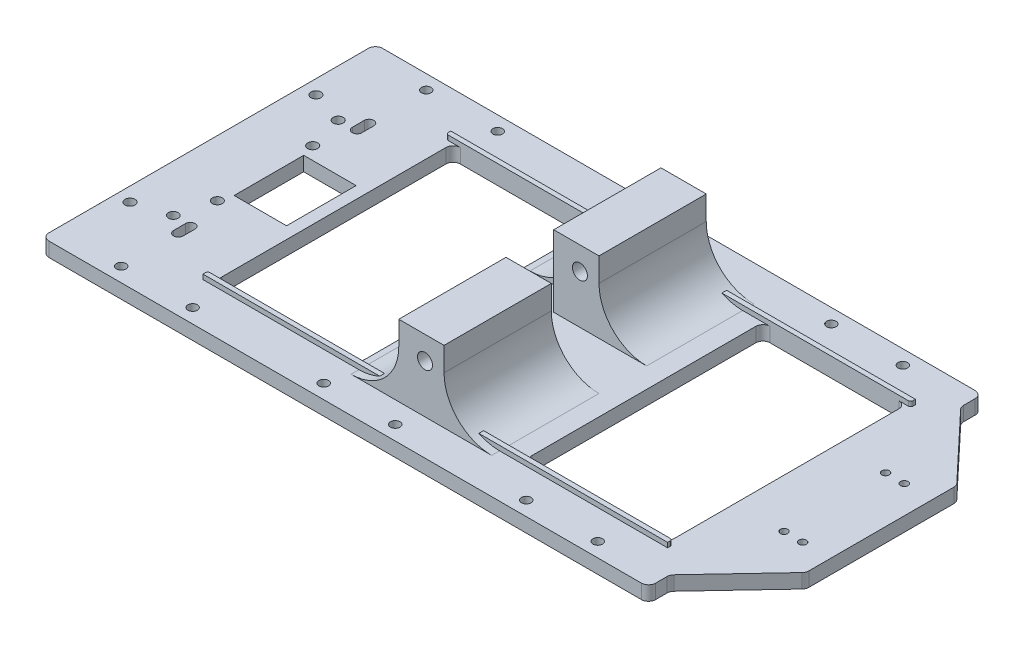
from build123d import *

# Parameters (mm, degrees)
SKETCH_1_R                = 2.1
SKETCH_1_R_2              = 2.05
SKETCH_1_R_3              = 1.55
SKETCH_1_R_4              = 2
SKETCH_1_R_5              = 1.6
SKETCH_1_R_6              = 1.5
SKETCH_1_R_7              = 6
SKETCH_1_W                = 22
SKETCH_1_H                = 29.2
EXTRUDE_1_DEPTH           = 6
EXTRUDE_START             = -6
SKETCH_3_W                = 203.58361069
SKETCH_3_H                = 116.131566858
SKETCH_3_R                = 2.1
SKETCH_3_R_2              = 1.5
SKETCH_3_R_3              = 1.6
SKETCH_3_R_4              = 6
EXTRUDE_2_DEPTH           = 6
CUT_EXTRUDE_1_DEPTH       = 4593.701999583
CUT_EXTRUDE_1_DEPTH_BACK  = 4593.701999583
EXTRUDE_3_DEPTH           = 2
SKETCH_8_W                = 16
SKETCH_8_H                = 45
EXTRUDE_4_DEPTH           = 30
EXTRUDE_5_DEPTH           = 125.021642
CUT_EXTRUDE_2_OUTLINE_W   = 23
CUT_EXTRUDE_2_OUTLINE_H   = 15
CUT_EXTRUDE_2_OUTLINE_H_2 = 20.021642237
CUT_EXTRUDE_2_OUTLINE_W_2 = 20.030662939
CUT_EXTRUDE_2_OUTLINE_W_3 = 20.50319438
CUT_EXTRUDE_2_DEPTH       = 30
SKETCH_12_R               = 3.15
CUT_EXTRUDE_4_DEPTH       = 4320.694389343
SKETCH_13_W               = 20
SKETCH_13_H               = 10
SKETCH_13_W_2             = 1.585481568
SKETCH_13_H_2             = 20.021642237
CUT_EXTRUDE_5_DEPTH       = 4593.796060895


# Read off the part's stored shape, not the designer's step: 切除-拉伸2
with BuildPart() as part:
    # 草图1 → 凸台-拉伸1 (new body)
    with BuildSketch(Plane(origin=(0, 0, 0), x_dir=(1, 0, 0), z_dir=(0, 1, 0))):
        with BuildLine():
            Line((4038.434618363, 1425.239502327), (4287.034512286, 1425.239502327))
            ThreePointArc((4287.034512286, 1425.239502327), (4289.15583263, 1426.118181984), (4290.034512286, 1428.239502327))
            Line((4290.034512286, 1428.239502327), (4290.034512286, 1433.049346517))
            ThreePointArc((4290.034512286, 1433.049346517), (4290.245938067, 1434.155625787), (4290.850414836, 1435.105974418))
            Line((4290.850414836, 1435.105974418), (4316.918828336, 1462.790105042))
            ThreePointArc((4316.918828336, 1462.790105042), (4317.523305104, 1463.740453674), (4317.734730885, 1464.846732944))
            Line((4317.734730885, 1464.846732944), (4317.734730885, 1525.653913947))
            ThreePointArc((4317.734730885, 1525.653913947), (4317.523305104, 1526.760193217), (4316.918828336, 1527.710541849))
            Line((4316.918828336, 1527.710541849), (4290.850414836, 1555.394672473))
            ThreePointArc((4290.850414836, 1555.394672473), (4290.245938067, 1556.345021104), (4290.034512286, 1557.451300374))
            Line((4290.034512286, 1557.451300374), (4290.034512286, 1562.261144564))
            ThreePointArc((4290.034512286, 1562.261144564), (4289.15583263, 1564.382464907), (4287.034512286, 1565.261144564))
            Line((4287.034512286, 1565.261144564), (4038.434618363, 1565.261144564))
            ThreePointArc((4038.434618363, 1565.261144564), (4036.313298019, 1564.382464907), (4035.434618363, 1562.261144564))
            Line((4035.434618363, 1562.261144564), (4035.434618363, 1428.239502327))
            ThreePointArc((4035.434618363, 1428.239502327), (4036.313298019, 1426.118181984), (4038.434618363, 1425.239502327))
        make_face()
        with Locations(Location((4041.306274282, 1456.388343445, 0), (0, 0, 270))):
            Circle(SKETCH_1_R, mode=Mode.SUBTRACT)
        with Locations(Location((4055.21317116, 1460.668720556, 0), (0, 0, 270))):
            Circle(SKETCH_1_R_2, mode=Mode.SUBTRACT)
        with Locations(Location((4041.306274282, 1534.388343445, 0), (0, 0, 270))):
            Circle(SKETCH_1_R, mode=Mode.SUBTRACT)
        with Locations(Location((4055.21317116, 1529.831926335, 0), (0, 0, 270))):
            Circle(SKETCH_1_R, mode=Mode.SUBTRACT)
        with Locations(Location((4059.124286282, 1515.223338779, 0), (0, 0, 270))):
            Circle(SKETCH_1_R, mode=Mode.SUBTRACT)
        with Locations(Location((4059.124286282, 1475.223338779, 0), (0, 0, 270))):
            Circle(SKETCH_1_R, mode=Mode.SUBTRACT)
        with Locations(Location((4298.199059339, 1473.937422498, 0), (0, 0, 270))):
            Circle(SKETCH_1_R_3, mode=Mode.SUBTRACT)
        with Locations(Location((4262.734565325, 1559.261144564, 0), (0, 0, 270))):
            Circle(SKETCH_1_R_4, mode=Mode.SUBTRACT)
        with Locations(Location((4306.013069352, 1516.563224393, 0), (0, 0, 270))):
            Circle(SKETCH_1_R_3, mode=Mode.SUBTRACT)
        with Locations(Location((4259.827612481, 1500.250323445, 0), (0, 0, 270))):
            Circle(SKETCH_1_R_5, mode=Mode.SUBTRACT)
        with Locations(Location((4298.199059339, 1516.563224393, 0), (0, 0, 270))):
            Circle(SKETCH_1_R_3, mode=Mode.SUBTRACT)
        with Locations(Location((4262.734565325, 1431.239502327, 0), (0, 0, 270))):
            Circle(SKETCH_1_R_4, mode=Mode.SUBTRACT)
        with Locations(Location((4306.013069352, 1473.937422498, 0), (0, 0, 270))):
            Circle(SKETCH_1_R_3, mode=Mode.SUBTRACT)
        with Locations(Location((4147.734565325, 1559.261144564, 0), (0, 0, 270))):
            Circle(SKETCH_1_R_4, mode=Mode.SUBTRACT)
        with Locations(Location((4232.734565325, 1559.261144564, 0), (0, 0, 270))):
            Circle(SKETCH_1_R_4, mode=Mode.SUBTRACT)
        with Locations(Location((4210.327612481, 1500.250323445, 0), (0, 0, 270))):
            Circle(SKETCH_1_R_5, mode=Mode.SUBTRACT)
        with Locations(Location((4101.306274282, 1456.388343445, 0), (0, 0, 270))):
            Circle(SKETCH_1_R, mode=Mode.SUBTRACT)
        with Locations(Location((4163.684053216, 1458.444726446, 0), (0, 0, 270))):
            Circle(SKETCH_1_R, mode=Mode.SUBTRACT)
        with Locations(Location((4133.21317116, 1525.250323445, 0), (0, 0, 270))):
            Circle(SKETCH_1_R, mode=Mode.SUBTRACT)
        with Locations(Location((4163.684053216, 1532.444726446, 0), (0, 0, 270))):
            Circle(SKETCH_1_R, mode=Mode.SUBTRACT)
        with Locations(Location((4101.306274282, 1534.388343445, 0), (0, 0, 270))):
            Circle(SKETCH_1_R, mode=Mode.SUBTRACT)
        with Locations(Location((4177.734565325, 1431.239502327, 0), (0, 0, 270))):
            Circle(SKETCH_1_R_4, mode=Mode.SUBTRACT)
        with Locations(Location((4155.21317116, 1525.250323445, 0), (0, 0, 270))):
            Circle(SKETCH_1_R, mode=Mode.SUBTRACT)
        with Locations(Location((4155.21317116, 1465.250323445, 0), (0, 0, 270))):
            Circle(SKETCH_1_R, mode=Mode.SUBTRACT)
        with Locations(Location((4130.827612481, 1490.250323445, 0), (0, 0, 270))):
            Circle(SKETCH_1_R_5, mode=Mode.SUBTRACT)
        with Locations(Location((4117.163901882, 1516.349188696, 0), (0, 0, 270))):
            Circle(SKETCH_1_R_6, mode=Mode.SUBTRACT)
        with Locations(Location((4181.163901882, 1474.349188696, 0), (0, 0, 270))):
            Circle(SKETCH_1_R_6, mode=Mode.SUBTRACT)
        with Locations(Location((4133.21317116, 1465.250323445, 0), (0, 0, 270))):
            Circle(SKETCH_1_R, mode=Mode.SUBTRACT)
        with Locations(Location((4062.734565325, 1559.261144564, 0), (0, 0, 270))):
            Circle(SKETCH_1_R_4, mode=Mode.SUBTRACT)
        with Locations(Location((4180.327612481, 1490.250323445, 0), (0, 0, 270))):
            Circle(SKETCH_1_R_5, mode=Mode.SUBTRACT)
        with Locations(Location((4099.124286282, 1515.223338779, 0), (0, 0, 270))):
            Circle(SKETCH_1_R, mode=Mode.SUBTRACT)
        with Locations(Location((4099.124286282, 1475.223338779, 0), (0, 0, 270))):
            Circle(SKETCH_1_R, mode=Mode.SUBTRACT)
        with Locations(Location((4181.163901882, 1516.259188696, 0), (0, 0, 270))):
            Circle(SKETCH_1_R_6, mode=Mode.SUBTRACT)
        with Locations(Location((4259.827612481, 1490.250323445, 0), (0, 0, 270))):
            Circle(SKETCH_1_R_5, mode=Mode.SUBTRACT)
        with Locations(Location((4147.734565325, 1431.239502327, 0), (0, 0, 270))):
            Circle(SKETCH_1_R_4, mode=Mode.SUBTRACT)
        with Locations(Location((4177.734565325, 1559.261144564, 0), (0, 0, 270))):
            Circle(SKETCH_1_R_4, mode=Mode.SUBTRACT)
        with Locations(Location((4130.827612481, 1500.250323445, 0), (0, 0, 270))):
            Circle(SKETCH_1_R_5, mode=Mode.SUBTRACT)
        with Locations(Location((4210.327612481, 1490.250323445, 0), (0, 0, 270))):
            Circle(SKETCH_1_R_5, mode=Mode.SUBTRACT)
        with Locations(Location((4180.327612481, 1500.250323445, 0), (0, 0, 270))):
            Circle(SKETCH_1_R_5, mode=Mode.SUBTRACT)
        with Locations(Location((4092.734565325, 1559.261144564, 0), (0, 0, 270))):
            Circle(SKETCH_1_R_4, mode=Mode.SUBTRACT)
        with Locations(Location((4117.163901882, 1474.349188696, 0), (0, 0, 270))):
            Circle(SKETCH_1_R_6, mode=Mode.SUBTRACT)
        with Locations(Location((4249.740991595, 1457.978301065, 0), (0, 0, 270))):
            Circle(SKETCH_1_R_7, mode=Mode.SUBTRACT)
        with Locations(Location((4232.734565325, 1431.239502327, 0), (0, 0, 270))):
            Circle(SKETCH_1_R_4, mode=Mode.SUBTRACT)
        with Locations(Location((4092.734565325, 1431.239502327, 0), (0, 0, 270))):
            Circle(SKETCH_1_R_4, mode=Mode.SUBTRACT)
        with Locations(Location((4062.734565325, 1431.239502327, 0), (0, 0, 270))):
            Circle(SKETCH_1_R_4, mode=Mode.SUBTRACT)
        with Locations((4071.728935132, 1495.250323445)):
            Rectangle(SKETCH_1_W, SKETCH_1_H, mode=Mode.SUBTRACT)
        with BuildLine():
            Line((4175.734565325, 1460.250323445), (4175.734565325, 1455.239502327))
            ThreePointArc((4175.734565325, 1455.239502327), (4177.734565325, 1453.239502327), (4179.734565325, 1455.239502327))
            Line((4179.734565325, 1455.239502327), (4179.734565325, 1460.250323445))
            ThreePointArc((4179.734565325, 1460.250323445), (4177.734565325, 1462.250323445), (4175.734565325, 1460.250323445))
        make_face(mode=Mode.SUBTRACT)
        with BuildLine():
            Line((4145.734565325, 1460.250323445), (4145.734565325, 1455.239502327))
            ThreePointArc((4145.734565325, 1455.239502327), (4147.734565325, 1453.239502327), (4149.734565325, 1455.239502327))
            Line((4149.734565325, 1455.239502327), (4149.734565325, 1460.250323445))
            ThreePointArc((4149.734565325, 1460.250323445), (4147.734565325, 1462.250323445), (4145.734565325, 1460.250323445))
        make_face(mode=Mode.SUBTRACT)
        with BuildLine():
            Line((4115.634682032, 1530.625710196), (4120.163799976, 1528.012910085))
            ThreePointArc((4120.163799976, 1528.012910085), (4123.03218741, 1528.78255515), (4122.262542344, 1531.650942585))
            Line((4122.262542344, 1531.650942585), (4117.7334244, 1534.263742696))
            ThreePointArc((4117.7334244, 1534.263742696), (4114.865036966, 1533.49409763), (4115.634682032, 1530.625710196))
        make_face(mode=Mode.SUBTRACT)
        with BuildLine():
            Line((4094.734565325, 1455.239502327), (4094.734565325, 1460.250323445))
            ThreePointArc((4094.734565325, 1460.250323445), (4092.734565325, 1462.250323445), (4090.734565325, 1460.250323445))
            Line((4090.734565325, 1460.250323445), (4090.734565325, 1455.239502327))
            ThreePointArc((4090.734565325, 1455.239502327), (4092.734565325, 1453.239502327), (4094.734565325, 1455.239502327))
        make_face(mode=Mode.SUBTRACT)
        with BuildLine():
            Line((4060.734565325, 1460.250323445), (4060.734565325, 1455.239502327))
            ThreePointArc((4060.734565325, 1455.239502327), (4062.734565325, 1453.239502327), (4064.734565325, 1455.239502327))
            Line((4064.734565325, 1455.239502327), (4064.734565325, 1460.250323445))
            ThreePointArc((4064.734565325, 1460.250323445), (4062.734565325, 1462.250323445), (4060.734565325, 1460.250323445))
        make_face(mode=Mode.SUBTRACT)
        with BuildLine():
            Line((4234.734565325, 1455.239502327), (4234.734565325, 1460.250323445))
            ThreePointArc((4234.734565325, 1460.250323445), (4232.734565325, 1462.250323445), (4230.734565325, 1460.250323445))
            Line((4230.734565325, 1460.250323445), (4230.734565325, 1455.239502327))
            ThreePointArc((4230.734565325, 1455.239502327), (4232.734565325, 1453.239502327), (4234.734565325, 1455.239502327))
        make_face(mode=Mode.SUBTRACT)
        with BuildLine():
            Line((4090.734565325, 1530.250323445), (4090.734565325, 1535.261144564))
            ThreePointArc((4090.734565325, 1535.261144564), (4092.734565325, 1537.261144564), (4094.734565325, 1535.261144564))
            Line((4094.734565325, 1535.261144564), (4094.734565325, 1530.250323445))
            ThreePointArc((4094.734565325, 1530.250323445), (4092.734565325, 1528.250323445), (4090.734565325, 1530.250323445))
        make_face(mode=Mode.SUBTRACT)
        with BuildLine():
            Line((4176.577612481, 1504.550323445), (4176.577612481, 1485.950323445))
            ThreePointArc((4176.577612481, 1485.950323445), (4176.284719262, 1485.243216664), (4175.577612481, 1484.950323445))
            Line((4175.577612481, 1484.950323445), (4135.577612481, 1484.950323445))
            ThreePointArc((4135.577612481, 1484.950323445), (4134.870505699, 1485.243216664), (4134.577612481, 1485.950323445))
            Line((4134.577612481, 1485.950323445), (4134.577612481, 1504.550323445))
            ThreePointArc((4134.577612481, 1504.550323445), (4134.870505699, 1505.257430227), (4135.577612481, 1505.550323445))
            Line((4135.577612481, 1505.550323445), (4175.577612481, 1505.550323445))
            ThreePointArc((4175.577612481, 1505.550323445), (4176.284719262, 1505.257430227), (4176.577612481, 1504.550323445))
        make_face(mode=Mode.SUBTRACT)
        with BuildLine():
            Line((4115.777160046, 1460.338807959), (4120.327870684, 1462.517704891))
            ThreePointArc((4120.327870684, 1462.517704891), (4123.053291883, 1461.572299952), (4122.134940744, 1458.837644142))
            Line((4122.134940744, 1458.837644142), (4117.628304985, 1456.568989631))
            ThreePointArc((4117.628304985, 1456.568989631), (4114.7990515, 1457.519108529), (4115.777160046, 1460.338807959))
        make_face(mode=Mode.SUBTRACT)
        with BuildLine():
            Line((4149.734565325, 1535.261144564), (4149.734565325, 1530.250323445))
            ThreePointArc((4149.734565325, 1530.250323445), (4147.734565325, 1528.250323445), (4145.734565325, 1530.250323445))
            Line((4145.734565325, 1530.250323445), (4145.734565325, 1535.261144564))
            ThreePointArc((4145.734565325, 1535.261144564), (4147.734565325, 1537.261144564), (4149.734565325, 1535.261144564))
        make_face(mode=Mode.SUBTRACT)
        with BuildLine():
            Line((4060.734565325, 1530.250323445), (4060.734565325, 1535.261144564))
            ThreePointArc((4060.734565325, 1535.261144564), (4062.734565325, 1537.261144564), (4064.734565325, 1535.261144564))
            Line((4064.734565325, 1535.261144564), (4064.734565325, 1530.250323445))
            ThreePointArc((4064.734565325, 1530.250323445), (4062.734565325, 1528.250323445), (4060.734565325, 1530.250323445))
        make_face(mode=Mode.SUBTRACT)
        with BuildLine():
            Line((4175.734565325, 1530.250323445), (4175.734565325, 1535.261144564))
            ThreePointArc((4175.734565325, 1535.261144564), (4177.734565325, 1537.261144564), (4179.734565325, 1535.261144564))
            Line((4179.734565325, 1535.261144564), (4179.734565325, 1530.250323445))
            ThreePointArc((4179.734565325, 1530.250323445), (4177.734565325, 1528.250323445), (4175.734565325, 1530.250323445))
        make_face(mode=Mode.SUBTRACT)
        with BuildLine():
            Line((4251.290991595, 1514.763224393), (4251.290991595, 1522.553887451))
            ThreePointArc((4251.290991595, 1522.553887451), (4249.740991595, 1524.103887451), (4248.190991595, 1522.553887451))
            Line((4248.190991595, 1522.553887451), (4248.190991595, 1514.763224393))
            ThreePointArc((4248.190991595, 1514.763224393), (4249.740991595, 1513.213223205), (4251.290991595, 1514.763224393))
        make_face(mode=Mode.SUBTRACT)
        with BuildLine():
            Line((4251.290991595, 1542.490804201), (4251.290991595, 1550.28146726))
            ThreePointArc((4251.290991595, 1550.28146726), (4249.740991595, 1551.83146726), (4248.190991595, 1550.28146726))
            Line((4248.190991595, 1550.28146726), (4248.190991595, 1542.490804201))
            ThreePointArc((4248.190991595, 1542.490804201), (4249.740991595, 1540.940803014), (4251.290991595, 1542.490804201))
        make_face(mode=Mode.SUBTRACT)
        with BuildLine():
            Line((4260.734565325, 1460.250323445), (4260.734565325, 1455.239502327))
            ThreePointArc((4260.734565325, 1455.239502327), (4262.734565325, 1453.239502327), (4264.734565325, 1455.239502327))
            Line((4264.734565325, 1455.239502327), (4264.734565325, 1460.250323445))
            ThreePointArc((4264.734565325, 1460.250323445), (4262.734565325, 1462.250323445), (4260.734565325, 1460.250323445))
        make_face(mode=Mode.SUBTRACT)
        with BuildLine():
            Line((4256.077612481, 1504.550323445), (4256.077612481, 1485.950323445))
            ThreePointArc((4256.077612481, 1485.950323445), (4255.784719262, 1485.243216664), (4255.077612481, 1484.950323445))
            Line((4255.077612481, 1484.950323445), (4215.077612481, 1484.950323445))
            ThreePointArc((4215.077612481, 1484.950323445), (4214.370505699, 1485.243216664), (4214.077612481, 1485.950323445))
            Line((4214.077612481, 1485.950323445), (4214.077612481, 1504.550323445))
            ThreePointArc((4214.077612481, 1504.550323445), (4214.370505699, 1505.257430227), (4215.077612481, 1505.550323445))
            Line((4215.077612481, 1505.550323445), (4255.077612481, 1505.550323445))
            ThreePointArc((4255.077612481, 1505.550323445), (4255.784719262, 1505.257430227), (4256.077612481, 1504.550323445))
        make_face(mode=Mode.SUBTRACT)
        with BuildLine():
            Line((4230.734565325, 1530.250323445), (4230.734565325, 1535.261144564))
            ThreePointArc((4230.734565325, 1535.261144564), (4232.734565325, 1537.261144564), (4234.734565325, 1535.261144564))
            Line((4234.734565325, 1535.261144564), (4234.734565325, 1530.250323445))
            ThreePointArc((4234.734565325, 1530.250323445), (4232.734565325, 1528.250323445), (4230.734565325, 1530.250323445))
        make_face(mode=Mode.SUBTRACT)
        with BuildLine():
            Line((4260.734565325, 1530.250323445), (4260.734565325, 1535.261144564))
            ThreePointArc((4260.734565325, 1535.261144564), (4262.734565325, 1537.261144564), (4264.734565325, 1535.261144564))
            Line((4264.734565325, 1535.261144564), (4264.734565325, 1530.250323445))
            ThreePointArc((4264.734565325, 1530.250323445), (4262.734565325, 1528.250323445), (4260.734565325, 1530.250323445))
        make_face(mode=Mode.SUBTRACT)
        with BuildLine():
            Line((4248.190991595, 1467.94675944), (4248.190991595, 1475.737422498))
            ThreePointArc((4248.190991595, 1475.737422498), (4249.740991595, 1477.287422498), (4251.290991595, 1475.737422498))
            Line((4251.290991595, 1475.737422498), (4251.290991595, 1467.94675944))
            ThreePointArc((4251.290991595, 1467.94675944), (4249.740991595, 1466.396758253), (4248.190991595, 1467.94675944))
        make_face(mode=Mode.SUBTRACT)
        with BuildLine():
            Line((4248.190991595, 1440.219179631), (4248.190991595, 1448.00984269))
            ThreePointArc((4248.190991595, 1448.00984269), (4249.740991595, 1449.55984269), (4251.290991595, 1448.00984269))
            Line((4251.290991595, 1448.00984269), (4251.290991595, 1440.219179631))
            ThreePointArc((4251.290991595, 1440.219179631), (4249.740991595, 1438.669178444), (4248.190991595, 1440.219179631))
        make_face(mode=Mode.SUBTRACT)
    extrude(amount=EXTRUDE_1_DEPTH)

    # 草图3 → 凸台-拉伸2 (add)
    # profile 1 of 2: a face of its own
    with BuildSketch(Plane(origin=(0, 6, 0), x_dir=(1, 0, 0), z_dir=(0, 1, 0)).offset(EXTRUDE_START)):
        with Locations((4186.606647737, 1493.877466352)):
            Rectangle(SKETCH_3_W, SKETCH_3_H)
    # profile 2 of 2: a face of its own
    with BuildSketch(Plane(origin=(0, 6, 0), x_dir=(1, 0, 0), z_dir=(0, 1, 0)).offset(EXTRUDE_START)):
        with Locations((4186.606647737, 1493.877466352)):
            Rectangle(SKETCH_3_W, SKETCH_3_H)
        with BuildLine():
            ThreePointArc((4094.734565325, 1455.239502327), (4092.734565325, 1453.239502327), (4090.734565325, 1455.239502327))
            Line((4090.734565325, 1455.239502327), (4090.734565325, 1460.250323445))
            ThreePointArc((4090.734565325, 1460.250323445), (4092.734565325, 1462.250323445), (4094.734565325, 1460.250323445))
            Line((4094.734565325, 1460.250323445), (4094.734565325, 1455.239502327))
        make_face(mode=Mode.SUBTRACT)
        with Locations((4101.306274282, 1456.388343445)):
            Circle(SKETCH_3_R, mode=Mode.SUBTRACT)
        with BuildLine():
            ThreePointArc((4117.628304985, 1456.568989631), (4114.7990515, 1457.519108529), (4115.777160046, 1460.338807959))
            Line((4115.777160046, 1460.338807959), (4120.327870684, 1462.517704891))
            ThreePointArc((4120.327870684, 1462.517704891), (4123.053291883, 1461.572299952), (4122.134940744, 1458.837644142))
            Line((4122.134940744, 1458.837644142), (4117.628304985, 1456.568989631))
        make_face(mode=Mode.SUBTRACT)
        with BuildLine():
            Line((4145.734565325, 1455.239502327), (4145.734565325, 1460.250323445))
            ThreePointArc((4145.734565325, 1460.250323445), (4147.734565325, 1462.250323445), (4149.734565325, 1460.250323445))
            Line((4149.734565325, 1460.250323445), (4149.734565325, 1455.239502327))
            ThreePointArc((4149.734565325, 1455.239502327), (4147.734565325, 1453.239502327), (4145.734565325, 1455.239502327))
        make_face(mode=Mode.SUBTRACT)
        with Locations((4163.684053216, 1458.444726446)):
            Circle(SKETCH_3_R, mode=Mode.SUBTRACT)
        with Locations((4099.124286282, 1475.223338779)):
            Circle(SKETCH_3_R, mode=Mode.SUBTRACT)
        with Locations((4133.21317116, 1465.250323445)):
            Circle(SKETCH_3_R, mode=Mode.SUBTRACT)
        with Locations((4117.163901882, 1474.349188696)):
            Circle(SKETCH_3_R_2, mode=Mode.SUBTRACT)
        with Locations((4155.21317116, 1465.250323445)):
            Circle(SKETCH_3_R, mode=Mode.SUBTRACT)
        with Locations((4130.827612481, 1490.250323445)):
            Circle(SKETCH_3_R_3, mode=Mode.SUBTRACT)
        with BuildLine():
            Line((4175.734565325, 1455.239502327), (4175.734565325, 1460.250323445))
            ThreePointArc((4175.734565325, 1460.250323445), (4177.734565325, 1462.250323445), (4179.734565325, 1460.250323445))
            Line((4179.734565325, 1460.250323445), (4179.734565325, 1455.239502327))
            ThreePointArc((4179.734565325, 1455.239502327), (4177.734565325, 1453.239502327), (4175.734565325, 1455.239502327))
        make_face(mode=Mode.SUBTRACT)
        with BuildLine():
            ThreePointArc((4234.734565325, 1455.239502327), (4232.734565325, 1453.239502327), (4230.734565325, 1455.239502327))
            Line((4230.734565325, 1455.239502327), (4230.734565325, 1460.250323445))
            ThreePointArc((4230.734565325, 1460.250323445), (4232.734565325, 1462.250323445), (4234.734565325, 1460.250323445))
            Line((4234.734565325, 1460.250323445), (4234.734565325, 1455.239502327))
        make_face(mode=Mode.SUBTRACT)
        with BuildLine():
            ThreePointArc((4251.290991595, 1440.219179631), (4249.740991595, 1438.669178444), (4248.190991595, 1440.219179631))
            Line((4248.190991595, 1440.219179631), (4248.190991595, 1448.00984269))
            ThreePointArc((4248.190991595, 1448.00984269), (4249.740991595, 1449.55984269), (4251.290991595, 1448.00984269))
            Line((4251.290991595, 1448.00984269), (4251.290991595, 1440.219179631))
        make_face(mode=Mode.SUBTRACT)
        with Locations((4249.740991595, 1457.978301065)):
            Circle(SKETCH_3_R_4, mode=Mode.SUBTRACT)
        with BuildLine():
            Line((4260.734565325, 1455.239502327), (4260.734565325, 1460.250323445))
            ThreePointArc((4260.734565325, 1460.250323445), (4262.734565325, 1462.250323445), (4264.734565325, 1460.250323445))
            Line((4264.734565325, 1460.250323445), (4264.734565325, 1455.239502327))
            ThreePointArc((4264.734565325, 1455.239502327), (4262.734565325, 1453.239502327), (4260.734565325, 1455.239502327))
        make_face(mode=Mode.SUBTRACT)
        with Locations((4181.163901882, 1474.349188696)):
            Circle(SKETCH_3_R_2, mode=Mode.SUBTRACT)
        with Locations((4180.327612481, 1490.250323445)):
            Circle(SKETCH_3_R_3, mode=Mode.SUBTRACT)
        with Locations((4210.327612481, 1490.250323445)):
            Circle(SKETCH_3_R_3, mode=Mode.SUBTRACT)
        with BuildLine():
            ThreePointArc((4251.290991595, 1467.94675944), (4249.740991595, 1466.396758253), (4248.190991595, 1467.94675944))
            Line((4248.190991595, 1467.94675944), (4248.190991595, 1475.737422498))
            ThreePointArc((4248.190991595, 1475.737422498), (4249.740991595, 1477.287422498), (4251.290991595, 1475.737422498))
            Line((4251.290991595, 1475.737422498), (4251.290991595, 1467.94675944))
        make_face(mode=Mode.SUBTRACT)
        with Locations((4259.827612481, 1490.250323445)):
            Circle(SKETCH_3_R_3, mode=Mode.SUBTRACT)
        with Locations((4099.124286282, 1515.223338779)):
            Circle(SKETCH_3_R, mode=Mode.SUBTRACT)
        with Locations((4130.827612481, 1500.250323445)):
            Circle(SKETCH_3_R_3, mode=Mode.SUBTRACT)
        with BuildLine():
            ThreePointArc((4175.577612481, 1505.550323445), (4176.284719262, 1505.257430227), (4176.577612481, 1504.550323445))
            Line((4176.577612481, 1504.550323445), (4176.577612481, 1485.950323445))
            ThreePointArc((4176.577612481, 1485.950323445), (4176.284719262, 1485.243216664), (4175.577612481, 1484.950323445))
            Line((4175.577612481, 1484.950323445), (4135.577612481, 1484.950323445))
            ThreePointArc((4135.577612481, 1484.950323445), (4134.870505699, 1485.243216664), (4134.577612481, 1485.950323445))
            Line((4134.577612481, 1485.950323445), (4134.577612481, 1504.550323445))
            ThreePointArc((4134.577612481, 1504.550323445), (4134.870505699, 1505.257430227), (4135.577612481, 1505.550323445))
            Line((4135.577612481, 1505.550323445), (4175.577612481, 1505.550323445))
        make_face(mode=Mode.SUBTRACT)
        with Locations((4117.163901882, 1516.349188696)):
            Circle(SKETCH_3_R_2, mode=Mode.SUBTRACT)
        with Locations((4133.21317116, 1525.250323445)):
            Circle(SKETCH_3_R, mode=Mode.SUBTRACT)
        with Locations((4155.21317116, 1525.250323445)):
            Circle(SKETCH_3_R, mode=Mode.SUBTRACT)
        with BuildLine():
            ThreePointArc((4094.734565325, 1530.250323445), (4092.734565325, 1528.250323445), (4090.734565325, 1530.250323445))
            Line((4090.734565325, 1530.250323445), (4090.734565325, 1535.261144564))
            ThreePointArc((4090.734565325, 1535.261144564), (4092.734565325, 1537.261144564), (4094.734565325, 1535.261144564))
            Line((4094.734565325, 1535.261144564), (4094.734565325, 1530.250323445))
        make_face(mode=Mode.SUBTRACT)
        with Locations((4101.306274282, 1534.388343445)):
            Circle(SKETCH_3_R, mode=Mode.SUBTRACT)
        with BuildLine():
            Line((4120.163799976, 1528.012910085), (4115.634682032, 1530.625710196))
            ThreePointArc((4115.634682032, 1530.625710196), (4114.865036966, 1533.49409763), (4117.7334244, 1534.263742696))
            Line((4117.7334244, 1534.263742696), (4122.262542344, 1531.650942585))
            ThreePointArc((4122.262542344, 1531.650942585), (4123.03218741, 1528.78255515), (4120.163799976, 1528.012910085))
        make_face(mode=Mode.SUBTRACT)
        with BuildLine():
            ThreePointArc((4145.734565325, 1535.261144564), (4147.734565325, 1537.261144564), (4149.734565325, 1535.261144564))
            Line((4149.734565325, 1535.261144564), (4149.734565325, 1530.250323445))
            ThreePointArc((4149.734565325, 1530.250323445), (4147.734565325, 1528.250323445), (4145.734565325, 1530.250323445))
            Line((4145.734565325, 1530.250323445), (4145.734565325, 1535.261144564))
        make_face(mode=Mode.SUBTRACT)
        with Locations((4163.684053216, 1532.444726446)):
            Circle(SKETCH_3_R, mode=Mode.SUBTRACT)
        with Locations((4180.327612481, 1500.250323445)):
            Circle(SKETCH_3_R_3, mode=Mode.SUBTRACT)
        with Locations((4210.327612481, 1500.250323445)):
            Circle(SKETCH_3_R_3, mode=Mode.SUBTRACT)
        with BuildLine():
            ThreePointArc((4255.077612481, 1505.550323445), (4255.784719262, 1505.257430227), (4256.077612481, 1504.550323445))
            Line((4256.077612481, 1504.550323445), (4256.077612481, 1485.950323445))
            ThreePointArc((4256.077612481, 1485.950323445), (4255.784719262, 1485.243216664), (4255.077612481, 1484.950323445))
            Line((4255.077612481, 1484.950323445), (4215.077612481, 1484.950323445))
            ThreePointArc((4215.077612481, 1484.950323445), (4214.370505699, 1485.243216664), (4214.077612481, 1485.950323445))
            Line((4214.077612481, 1485.950323445), (4214.077612481, 1504.550323445))
            ThreePointArc((4214.077612481, 1504.550323445), (4214.370505699, 1505.257430227), (4215.077612481, 1505.550323445))
            Line((4215.077612481, 1505.550323445), (4255.077612481, 1505.550323445))
        make_face(mode=Mode.SUBTRACT)
        with Locations((4181.163901882, 1516.259188696)):
            Circle(SKETCH_3_R_2, mode=Mode.SUBTRACT)
        with Locations((4259.827612481, 1500.250323445)):
            Circle(SKETCH_3_R_3, mode=Mode.SUBTRACT)
        with BuildLine():
            Line((4251.290991595, 1522.553887451), (4251.290991595, 1514.763224393))
            ThreePointArc((4251.290991595, 1514.763224393), (4249.740991595, 1513.213223205), (4248.190991595, 1514.763224393))
            Line((4248.190991595, 1514.763224393), (4248.190991595, 1522.553887451))
            ThreePointArc((4248.190991595, 1522.553887451), (4249.740991595, 1524.103887451), (4251.290991595, 1522.553887451))
        make_face(mode=Mode.SUBTRACT)
        with BuildLine():
            ThreePointArc((4179.734565325, 1530.250323445), (4177.734565325, 1528.250323445), (4175.734565325, 1530.250323445))
            Line((4175.734565325, 1530.250323445), (4175.734565325, 1535.261144564))
            ThreePointArc((4175.734565325, 1535.261144564), (4177.734565325, 1537.261144564), (4179.734565325, 1535.261144564))
            Line((4179.734565325, 1535.261144564), (4179.734565325, 1530.250323445))
        make_face(mode=Mode.SUBTRACT)
        with BuildLine():
            ThreePointArc((4234.734565325, 1530.250323445), (4232.734565325, 1528.250323445), (4230.734565325, 1530.250323445))
            Line((4230.734565325, 1530.250323445), (4230.734565325, 1535.261144564))
            ThreePointArc((4230.734565325, 1535.261144564), (4232.734565325, 1537.261144564), (4234.734565325, 1535.261144564))
            Line((4234.734565325, 1535.261144564), (4234.734565325, 1530.250323445))
        make_face(mode=Mode.SUBTRACT)
        with BuildLine():
            ThreePointArc((4264.734565325, 1530.250323445), (4262.734565325, 1528.250323445), (4260.734565325, 1530.250323445))
            Line((4260.734565325, 1530.250323445), (4260.734565325, 1535.261144564))
            ThreePointArc((4260.734565325, 1535.261144564), (4262.734565325, 1537.261144564), (4264.734565325, 1535.261144564))
            Line((4264.734565325, 1535.261144564), (4264.734565325, 1530.250323445))
        make_face(mode=Mode.SUBTRACT)
        with BuildLine():
            Line((4251.290991595, 1550.28146726), (4251.290991595, 1542.490804201))
            ThreePointArc((4251.290991595, 1542.490804201), (4249.740991595, 1540.940803014), (4248.190991595, 1542.490804201))
            Line((4248.190991595, 1542.490804201), (4248.190991595, 1550.28146726))
            ThreePointArc((4248.190991595, 1550.28146726), (4249.740991595, 1551.83146726), (4251.290991595, 1550.28146726))
        make_face(mode=Mode.SUBTRACT)
    extrude(amount=EXTRUDE_2_DEPTH)

    # 草图4 → 切除-拉伸1 (cut, two sides: drawn at the far end of the back side and taken through both)
    with BuildSketch(Plane(origin=(0, 6, 0), x_dir=(1, 0, 0), z_dir=(0, 1, 0)).offset(-CUT_EXTRUDE_1_DEPTH_BACK)):
        with BuildLine():
            Line((4090.734730885, 1545.545248487), (4144.734730885, 1545.545248487))
            ThreePointArc((4144.734730885, 1545.545248487), (4146.856051229, 1544.666568831), (4147.734730885, 1542.545248487))
            Line((4147.734730885, 1542.545248487), (4147.734730885, 1448.545248487))
            ThreePointArc((4147.734730885, 1448.545248487), (4146.856051229, 1446.423928144), (4144.734730885, 1445.545248487))
            Line((4144.734730885, 1445.545248487), (4090.734730885, 1445.545248487))
            ThreePointArc((4090.734730885, 1445.545248487), (4088.613410542, 1446.423928144), (4087.734730885, 1448.545248487))
            Line((4087.734730885, 1448.545248487), (4087.734730885, 1542.545248487))
            ThreePointArc((4087.734730885, 1542.545248487), (4088.613410542, 1544.666568831), (4090.734730885, 1545.545248487))
        make_face()
        with BuildLine():
            Line((4220.734730885, 1545.545248487), (4274.734730885, 1545.545248487))
            ThreePointArc((4274.734730885, 1545.545248487), (4276.856051229, 1544.666568831), (4277.734730885, 1542.545248487))
            Line((4277.734730885, 1542.545248487), (4277.734730885, 1448.545248487))
            ThreePointArc((4277.734730885, 1448.545248487), (4276.856051229, 1446.423928144), (4274.734730885, 1445.545248487))
            Line((4274.734730885, 1445.545248487), (4220.734730885, 1445.545248487))
            ThreePointArc((4220.734730885, 1445.545248487), (4218.613410542, 1446.423928144), (4217.734730885, 1448.545248487))
            Line((4217.734730885, 1448.545248487), (4217.734730885, 1542.545248487))
            ThreePointArc((4217.734730885, 1542.545248487), (4218.613410542, 1544.666568831), (4220.734730885, 1545.545248487))
        make_face()
    extrude(amount=CUT_EXTRUDE_1_DEPTH + CUT_EXTRUDE_1_DEPTH_BACK, mode=Mode.SUBTRACT)

    # 草图6 → 凸台-拉伸3 (add)
    with BuildSketch(Plane(origin=(0, 6, 0), x_dir=(1, 0, 0), z_dir=(0, 1, 0))):
        with BuildLine():
            Line((4085.734730885, 1545.545248487), (4278.734730885, 1545.545248487))
            ThreePointArc((4278.734730885, 1545.545248487), (4279.441837666, 1545.838141706), (4279.734730885, 1546.545248487))
            Line((4279.734730885, 1546.545248487), (4279.734730885, 1547.545248487))
            Line((4279.734730885, 1547.545248487), (4084.734730885, 1547.545248487))
            Line((4084.734730885, 1547.545248487), (4084.734730885, 1546.545248487))
            ThreePointArc((4084.734730885, 1546.545248487), (4085.027624104, 1545.838141706), (4085.734730885, 1545.545248487))
        make_face()
        with BuildLine():
            Line((4279.734730885, 1444.545248487), (4279.734730885, 1443.545248487))
            Line((4279.734730885, 1443.545248487), (4084.734730885, 1443.545248487))
            Line((4084.734730885, 1443.545248487), (4084.734730885, 1444.545248487))
            ThreePointArc((4084.734730885, 1444.545248487), (4085.027624104, 1445.252355269), (4085.734730885, 1445.545248487))
            Line((4085.734730885, 1445.545248487), (4278.734730885, 1445.545248487))
            ThreePointArc((4278.734730885, 1445.545248487), (4279.441837666, 1445.252355269), (4279.734730885, 1444.545248487))
        make_face()
    extrude(amount=EXTRUDE_3_DEPTH)

    # 草图8 → 凸台-拉伸4 (add)
    with BuildSketch(Plane(origin=(0, 6, 0), x_dir=(1, 0, 0), z_dir=(0, 1, 0))):
        with Locations((4181.234730885, 1462.739502327)):
            Rectangle(SKETCH_8_W, SKETCH_8_H)
        with Locations((4181.234730885, 1527.761144564)):
            Rectangle(SKETCH_8_W, SKETCH_8_H)
    extrude(amount=EXTRUDE_4_DEPTH)

    # 草图9 → 凸台-拉伸5 (add, through all)
    with BuildSketch(Plane(origin=(0, 0, -1550.261144564), x_dir=(-1, 0, 0), z_dir=(0, 0, -1))):
        with BuildLine():
            Line((-4170.234730885, 36), (-4173.234730885, 36))
            Line((-4173.234730885, 36), (-4173.234730885, 6))
            Line((-4173.234730885, 6), (-4150.234730885, 6))
            ThreePointArc((-4150.234730885, 6), (-4164.376866509, 11.857864376), (-4170.234730885, 26))
            Line((-4170.234730885, 26), (-4170.234730885, 36))
        make_face()
        with BuildLine():
            Line((-4189.234730885, 6), (-4189.234730885, 26))
            ThreePointArc((-4189.234730885, 26), (-4195.092595261, 11.857864376), (-4209.234730885, 6))
            Line((-4209.234730885, 6), (-4189.234730885, 6))
        make_face()
    extrude(amount=-EXTRUDE_5_DEPTH)

    # 切除-拉伸2 outline → 切除-拉伸2 (cut)
    with BuildSketch(Plane(origin=(0, 6, 0), x_dir=(1, 0, 0), z_dir=(0, 1, 0))):
        with Locations((4161.734730885, 1432.739502327)):
            Rectangle(CUT_EXTRUDE_2_OUTLINE_W, CUT_EXTRUDE_2_OUTLINE_H)
        with Locations((4161.734730885, 1495.250323446)):
            Rectangle(CUT_EXTRUDE_2_OUTLINE_W, CUT_EXTRUDE_2_OUTLINE_H_2)
        with Locations((4199.250062355, 1432.739502327)):
            Rectangle(CUT_EXTRUDE_2_OUTLINE_W_2, CUT_EXTRUDE_2_OUTLINE_H)
        with Locations((4199.486328075, 1495.250323446)):
            Rectangle(CUT_EXTRUDE_2_OUTLINE_W_3, CUT_EXTRUDE_2_OUTLINE_H_2)
    extrude(amount=CUT_EXTRUDE_2_DEPTH, mode=Mode.SUBTRACT)

    # 草图12 → 切除-拉伸4 (cut, through all)
    with BuildSketch(Plane(origin=(0, 0, -1550.261144564), x_dir=(-1, 0, 0), z_dir=(0, 0, -1))):
        with Locations((-4181.234730885, 26.3)):
            Circle(SKETCH_12_R)
    extrude(amount=-CUT_EXTRUDE_4_DEPTH, mode=Mode.SUBTRACT)

    # 草图13 → 切除-拉伸5 (cut, through all)
    with BuildSketch(Plane(origin=(0, 6, 0), x_dir=(1, 0, 0), z_dir=(0, 1, 0))):
        with Locations((4160.234730885, 1480.239502327)):
            Rectangle(SKETCH_13_W, SKETCH_13_H)
        with Locations((4160.234730885, 1510.261144564)):
            Rectangle(SKETCH_13_W, SKETCH_13_H)
        with Locations((4208.441990101, 1495.250323446)):
            Rectangle(SKETCH_13_W_2, SKETCH_13_H_2)
    extrude(amount=CUT_EXTRUDE_5_DEPTH, mode=Mode.SUBTRACT)


solid = part.part
